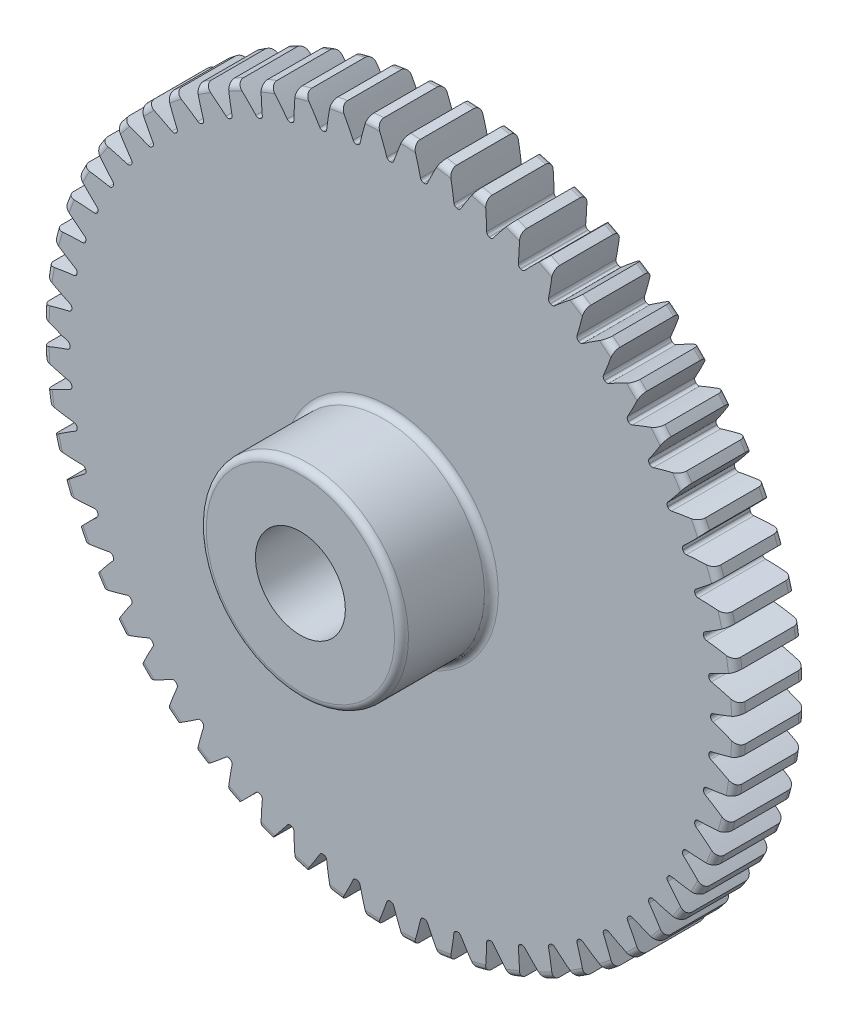
from build123d import *

# Parameters (mm, degrees)
FILLET2_R          = 0.62
CUT_EXTRUDE2_DEPTH = 45.564560049
CIRPATTERN1_COUNT  = 60


with BuildPart() as part:
    # Sketch4 → Revolve1 (revolve)
    with BuildSketch(Plane(origin=(0, 0, 0), x_dir=(0, 0, -1), z_dir=(1, 0, 0))):
        Polygon((-14, 4), (-14, 9), (-6, 9), (-6, 31), (0, 31), (0, 4), align=None)
    revolve(axis=Axis((0, 0, 6), (0, 0, 1)))

    # Fillet2
    fillet2_edges = [part.edges().sort_by_distance(p)[0] for p in [
        (0, -9, 14),
        (0, -9, 6),
        (0, -31, 6),
        (0, -31, 0),
    ]]
    fillet(fillet2_edges, radius=FILLET2_R)

    # Sketch7 → Cut-Extrude2 (cut, through all)
    with BuildSketch(Plane.XY.offset(6)):
        with BuildLine():
            ThreePointArc((-0.027924152, 28.49998632), (0, 28.5), (0.027924152, 28.49998632))
            ThreePointArc((0.027924152, 28.49998632), (0.20257511, 28.555850808), (0.31209617, 28.702918602))
            ThreePointArc((0.31209617, 28.702918602), (0.730254377, 29.848919172), (1.194657711, 30.976971978))
            ThreePointArc((1.194657711, 30.976971978), (0, 31), (-1.194657711, 30.976971978))
            ThreePointArc((-1.194657711, 30.976971978), (-0.730254377, 29.848919172), (-0.31209617, 28.702918602))
            ThreePointArc((-0.31209617, 28.702918602), (-0.20257511, 28.555850808), (-0.027924152, 28.49998632))
        make_face()
    cut_extrude2 = extrude(amount=-CUT_EXTRUDE2_DEPTH, mode=Mode.SUBTRACT)

    # CirPattern1: Cut-Extrude2 ×60 about axis
    cirpattern1_axis = Axis((0, 0, 14), (0, 0, -1))
    for i in range(1, CIRPATTERN1_COUNT):
        add(cut_extrude2.rotate(cirpattern1_axis, i * 360 / CIRPATTERN1_COUNT), mode=Mode.SUBTRACT)


solid = part.part
